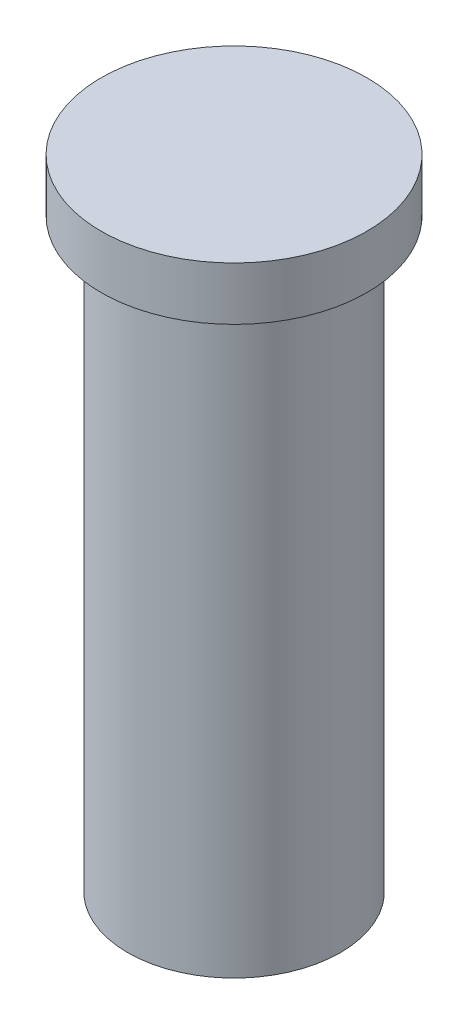
from build123d import *


with BuildPart() as part:
    # Sketch1 → Revolve1 (revolve)
    with BuildSketch(Plane.XY):
        Polygon((0, 12), (2.5, 12), (2.5, 11), (2, 11), (2, 0), (0, 0), align=None)
    revolve(axis=Axis((0, 0, 0), (0, 1, 0)))


solid = part.part
